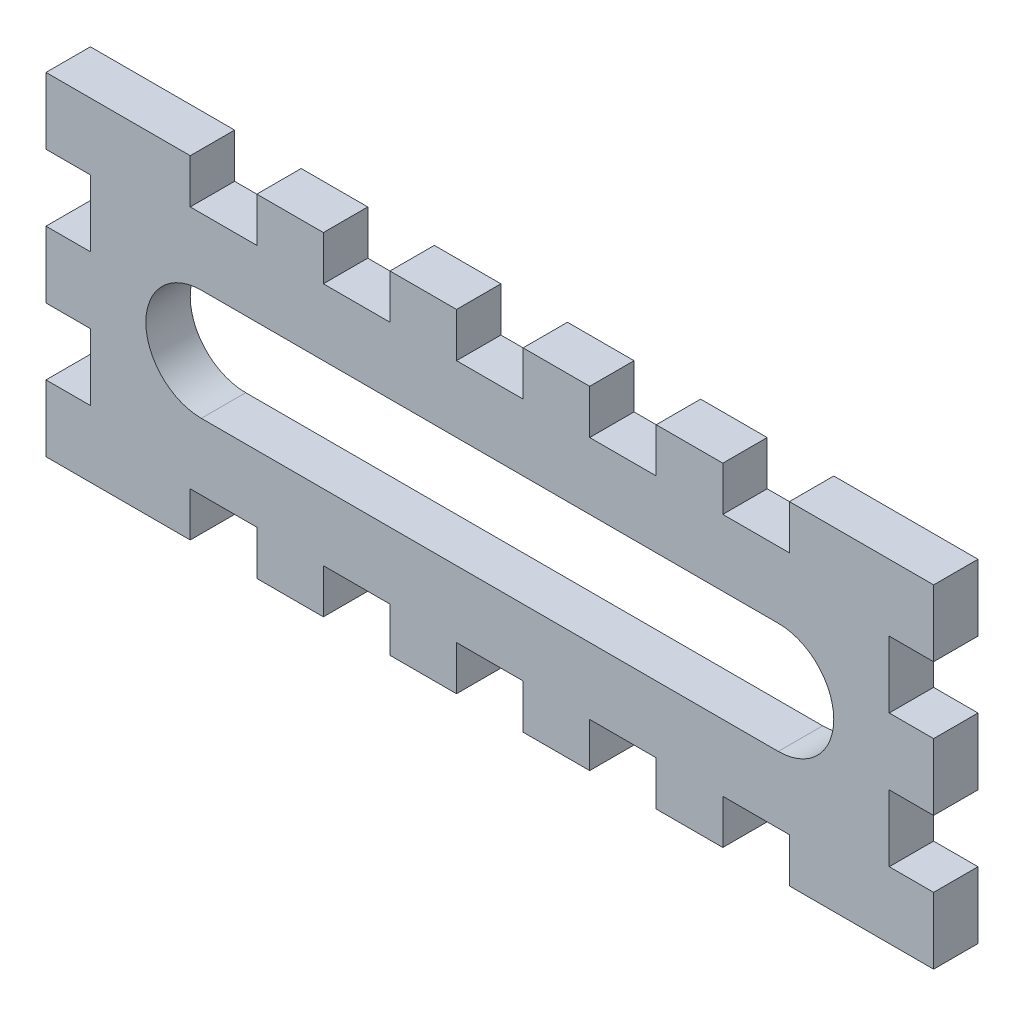
from build123d import *

# Parameters (mm, degrees)
SKETCH1_W           = 127
SKETCH1_H           = 47.625
BOSS_EXTRUDE1_DEPTH = 6.35
SKETCH2_W           = 9.525
SKETCH2_H           = 12.7
CUT_EXTRUDE1_DEPTH  = 270.065952098
LPATTERN1_COUNT     = 3
LPATTERN1_PITCH     = 19.05
LPATTERN1_COL_COUNT = 3
LPATTERN1_COL_PITCH = 19.05
CUT_EXTRUDE3_DEPTH  = 270.065952098
CAVITY1_START       = 122.897475598
CAVITY1_OUTLINE_W   = 6.35
CAVITY1_OUTLINE_H   = 6.35
CAVITY1_DEPTH       = 9.525
CAVITY1_START_2     = 141.947475598
CAVITY1_2_OUTLINE_W = 6.35
CAVITY1_2_OUTLINE_H = 6.35
CAVITY1_2_DEPTH     = 9.525


# Read off the part's stored shape, not the designer's step: Cavity1
with BuildPart() as part:
    # Sketch1 → Boss-Extrude1 (new body)
    with BuildSketch(Plane.XY):
        with Locations((151.990085455, 137.184975598)):
            Rectangle(SKETCH1_W, SKETCH1_H)
    extrude(amount=-BOSS_EXTRUDE1_DEPTH)

    # Sketch2 → Cut-Extrude1 (cut, through all)
    with BuildSketch(Plane(origin=(0, 0, -6.35), x_dir=(-1, 0, 0), z_dir=(0, 0, -1))):
        with Locations((-151.990085455, 160.997475598)):
            Rectangle(SKETCH2_W, SKETCH2_H)
        with Locations((-151.990085455, 113.372475598)):
            Rectangle(SKETCH2_W, SKETCH2_H)
    cut_extrude1 = extrude(amount=-CUT_EXTRUDE1_DEPTH, mode=Mode.SUBTRACT)

    # LPattern1: Cut-Extrude1 ×3
    with Locations(*[(-i * LPATTERN1_PITCH, 0, 0) for i in range(1, LPATTERN1_COUNT)]):
        add(cut_extrude1, mode=Mode.SUBTRACT)

    # LPattern1 col: Cut-Extrude1 ×3
    with Locations(*[(i * LPATTERN1_COL_PITCH, 0, 0) for i in range(1, LPATTERN1_COL_COUNT)]):
        add(cut_extrude1, mode=Mode.SUBTRACT)

    # Sketch3 → Cut-Extrude3 (cut, through all)
    with BuildSketch(Plane(origin=(0, 0, -6.35), x_dir=(-1, 0, 0), z_dir=(0, 0, -1))):
        with BuildLine():
            Line((-193.265085455, 145.122475598), (-110.715085455, 145.122475598))
            ThreePointArc((-110.715085455, 145.122475598), (-102.777585455, 137.184975598), (-110.715085455, 129.247475598))
            Line((-110.715085455, 129.247475598), (-193.265085455, 129.247475598))
            ThreePointArc((-193.265085455, 129.247475598), (-201.202585455, 137.184975598), (-193.265085455, 145.122475598))
        make_face()
    extrude(amount=-CUT_EXTRUDE3_DEPTH, mode=Mode.SUBTRACT)

    # Cavity1 outline → Cavity1 (cut)
    with BuildSketch(Plane(origin=(0, 0, 0), x_dir=(1, 0, 0), z_dir=(0, 1, 0)).offset(CAVITY1_START)):
        with Locations((91.665085455, 3.175)):
            Rectangle(CAVITY1_OUTLINE_W, CAVITY1_OUTLINE_H)
        with Locations((212.315085455, 3.175)):
            Rectangle(CAVITY1_OUTLINE_W, CAVITY1_OUTLINE_H)
    extrude(amount=CAVITY1_DEPTH, mode=Mode.SUBTRACT)

    # Cavity1 2 outline → Cavity1 2 (cut)
    with BuildSketch(Plane(origin=(0, 0, 0), x_dir=(1, 0, 0), z_dir=(0, 1, 0)).offset(CAVITY1_START_2)):
        with Locations((91.665085455, 3.175)):
            Rectangle(CAVITY1_2_OUTLINE_W, CAVITY1_2_OUTLINE_H)
        with Locations((212.315085455, 3.175)):
            Rectangle(CAVITY1_2_OUTLINE_W, CAVITY1_2_OUTLINE_H)
    extrude(amount=CAVITY1_2_DEPTH, mode=Mode.SUBTRACT)


solid = part.part
